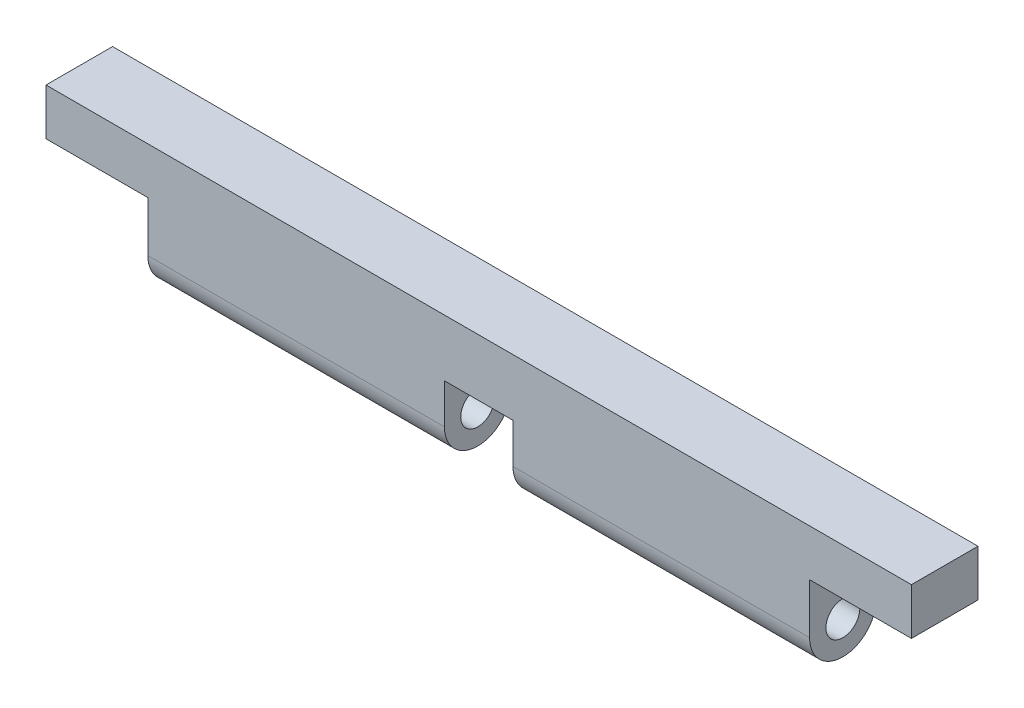
from build123d import *

# Parameters (mm, degrees)
BOSS_EXTRUDE1_DEPTH = 5
SKETCH2_R           = 2.55
CUT_EXTRUDE1_DEPTH  = 131.560330882
FILLET1_R           = 5


with BuildPart() as part:
    # Sketch1 → Boss-Extrude1 (new, symmetric)
    with BuildSketch(Plane.XY):
        Polygon((-49.7, 1.55), (-49.7, -11), (-5.15, -11), (-5.15, 0), (5.15, 0), (5.15, -11), (49.7, -11), (49.7, 1.55), (56, 1.55), (65, 1.55), (65, 8.55), (-65, 8.55), (-65, 1.55), (-56, 1.55), align=None)
    extrude(amount=BOSS_EXTRUDE1_DEPTH, both=True)

    # Sketch2 → Cut-Extrude1 (cut, through all)
    with BuildSketch(Plane.ZY.offset(65)):
        with Locations((0, -5.95)):
            Circle(SKETCH2_R)
    extrude(amount=-CUT_EXTRUDE1_DEPTH, mode=Mode.SUBTRACT)

    # Fillet1
    fillet1_edges = [part.edges().sort_by_distance(p)[0] for p in [
        (-27.425, -11, 5),
        (27.425, -11, 5),
        (-27.425, -11, -5),
        (27.425, -11, -5),
    ]]
    fillet(fillet1_edges, radius=FILLET1_R - 0.0001)  # a hair under: the kernel refuses the full size


solid = part.part
